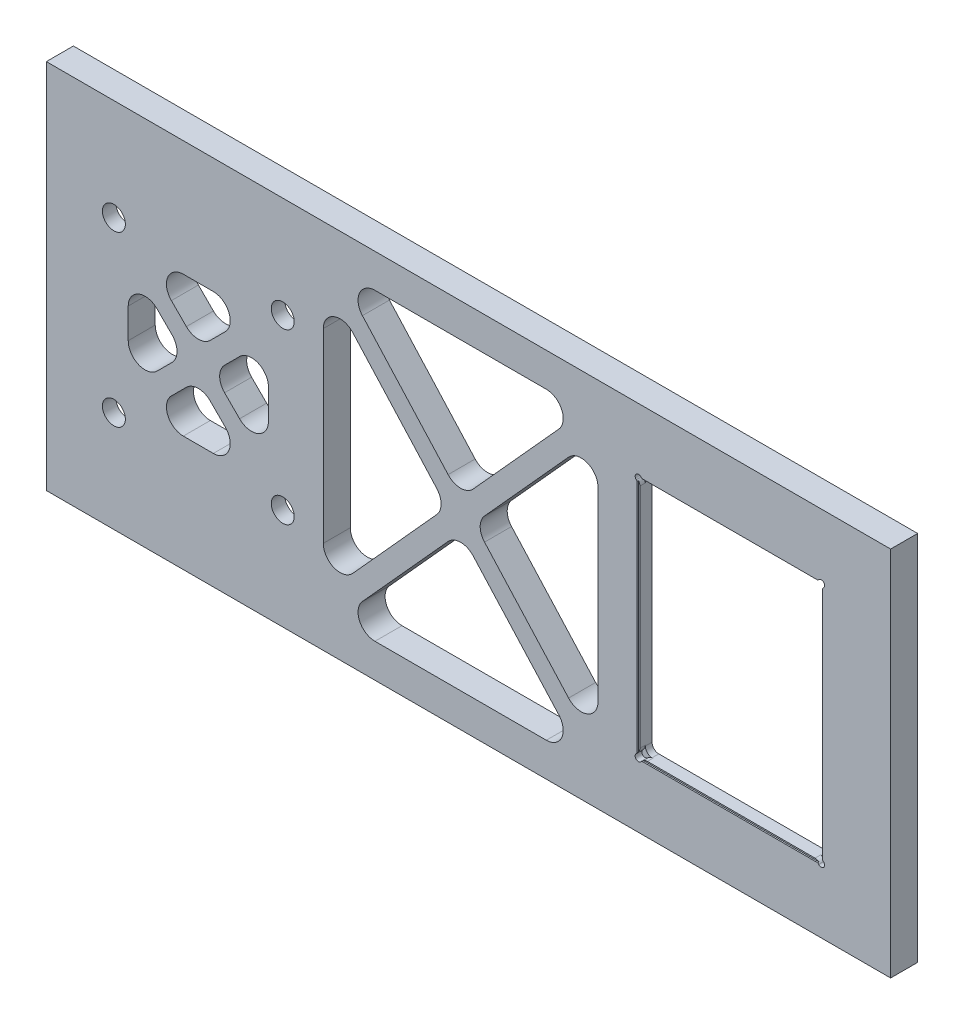
from build123d import *

# Parameters (mm, degrees)
SKETCH1_R           = 1.6999999999999995
SKETCH1_W           = 27.05000000000001
SKETCH1_H           = 35.849999999999994
BOSS_EXTRUDE1_DEPTH = 4
SKETCH2_R           = 0.49999999999999917
CUT_EXTRUDE1_DEPTH  = 1
FILLET1_R           = 1
FILLET2_R           = 1
SKETCH7_W           = 27.450000000000074
SKETCH7_H           = 36.250000000000014
CUT_EXTRUDE2_DEPTH  = 0.2
CUT_EXTRUDE3_DEPTH  = 2
CUT_EXTRUDE4_DEPTH  = 1
CUT_EXTRUDE5_DEPTH  = 137.6235704408284
CUT_EXTRUDE6_DEPTH  = 137.6235704408284
FILLET3_R           = 2.5
SKETCH12_R          = 4.999999999999999
SKETCH12_R_2        = 5.000000000000001
CUT_EXTRUDE7_DEPTH  = 2


with BuildPart() as part:
    # Sketch1 → Boss-Extrude1 (new body)
    with BuildSketch(Plane.XY):
        Polygon((0, 0), (125, 2.776e-14), (125, 54.99999999999999), (0, 54.99999999999999), align=None)
        with Locations((10, 39.99999999999999)):
            Circle(SKETCH1_R, mode=Mode.SUBTRACT)
        with Locations((35, 39.999999999999986)):
            Circle(SKETCH1_R, mode=Mode.SUBTRACT)
        with Locations((10, 15)):
            Circle(SKETCH1_R, mode=Mode.SUBTRACT)
        with Locations((35, 15.000000000000014)):
            Circle(SKETCH1_R, mode=Mode.SUBTRACT)
        with Locations((101.2, 27.500000000000007)):
            Rectangle(SKETCH1_W, SKETCH1_H, mode=Mode.SUBTRACT)
    extrude(amount=BOSS_EXTRUDE1_DEPTH)

    # Sketch2 → Cut-Extrude1 (cut)
    with BuildSketch(Plane.XY.offset(4)):
        with Locations((87.675, 45.425000000000004)):
            Circle(SKETCH2_R)
        with Locations((114.72500000000001, 45.425000000000004)):
            Circle(SKETCH2_R)
        with Locations((87.675, 9.575000000000006)):
            Circle(SKETCH2_R)
        with Locations((114.72500000000001, 9.575000000000006)):
            Circle(SKETCH2_R)
    extrude(amount=-CUT_EXTRUDE1_DEPTH, mode=Mode.SUBTRACT)

    # Fillet1
    # the kernel refuses this fillet: 1 mm, written as the material it adds along each edge
    with BuildSketch(Plane(origin=(114.72500000000001, 9.575000000000006, 0), x_dir=(-1, 0, 0), z_dir=(0, 0, 1))) as fillet1_piece_1_section:
        with BuildLine():
            CenterArc((FILLET1_R, -FILLET1_R), FILLET1_R, 90, 90.00000000000023)
            Line((0, -FILLET1_R), (0, 0))
            Line((0, 0), (FILLET1_R, 0))
        make_face()
    fillet1_piece_1 = extrude(amount=5.500000000000009, mode=Mode.PRIVATE)
    fillet1_piece_1 = split(fillet1_piece_1, bisect_by=Plane(origin=(114.10706425748403, 9.617383677219156, 4), z_dir=(0, 0, -1)), keep=Keep.TOP, mode=Mode.PRIVATE)
    fillet1_piece_1 = fillet1_piece_1 - Plane(origin=(114.72500000000001, 9.575000000000006, 1.5000000000000009), x_dir=(1, 0, 0), z_dir=(0, 0, 1)) * Cylinder(0.49999999999999917, 16, mode=Mode.PRIVATE)
    add(fillet1_piece_1)
    with BuildSketch(Plane(origin=(114.72500000000001, 9.575000000000006, 0), x_dir=(-1, 0, 0), z_dir=(0, 0, 1))) as fillet1_piece_2:
        with BuildLine():
            CenterArc((FILLET1_R, -FILLET1_R), FILLET1_R, 90, 90.00000000000023)
            Line((0, -FILLET1_R), (0, 0))
            Line((0, 0), (FILLET1_R, 0))
        make_face()
    extrude(amount=3)
    with BuildSketch(Plane(origin=(87.675, 9.575000000000006, 0), x_dir=(0, 1, 0), z_dir=(0, 0, 1))) as fillet1_piece_3_section:
        with BuildLine():
            CenterArc((FILLET1_R, -FILLET1_R), FILLET1_R, 90, 90)
            Line((0, -FILLET1_R), (0, 0))
            Line((0, 0), (FILLET1_R, 0))
        make_face()
    fillet1_piece_3 = extrude(amount=5.5, mode=Mode.PRIVATE)
    fillet1_piece_3 = split(fillet1_piece_3, bisect_by=Plane(origin=(87.71738367721915, 10.192935742515996, 4), z_dir=(0, 0, -1)), keep=Keep.TOP, mode=Mode.PRIVATE)
    fillet1_piece_3 = fillet1_piece_3 - Plane(origin=(87.675, 9.575000000000006, 1.5000000000000022), x_dir=(1, 0, 0), z_dir=(0, 0, 1)) * Cylinder(0.49999999999999917, 15, mode=Mode.PRIVATE)
    add(fillet1_piece_3)
    with BuildSketch(Plane(origin=(87.675, 9.575000000000006, 0), x_dir=(0, 1, 0), z_dir=(0, 0, 1))) as fillet1_piece_4:
        with BuildLine():
            CenterArc((FILLET1_R, -FILLET1_R), FILLET1_R, 90, 90)
            Line((0, -FILLET1_R), (0, 0))
            Line((0, 0), (FILLET1_R, 0))
        make_face()
    extrude(amount=3)
    with BuildSketch(Plane(origin=(114.72500000000001, 45.425000000000004, 0), x_dir=(0, -1, 0), z_dir=(0, 0, 1))) as fillet1_piece_5_section:
        with BuildLine():
            CenterArc((FILLET1_R, -FILLET1_R), FILLET1_R, 90, 90)
            Line((0, -FILLET1_R), (0, 0))
            Line((0, 0), (FILLET1_R, 0))
        make_face()
    fillet1_piece_5 = extrude(amount=5.5, mode=Mode.PRIVATE)
    fillet1_piece_5 = split(fillet1_piece_5, bisect_by=Plane(origin=(114.68261632278086, 44.807064257484015, 4), z_dir=(0, 0, -1)), keep=Keep.TOP, mode=Mode.PRIVATE)
    fillet1_piece_5 = fillet1_piece_5 - Plane(origin=(114.72500000000001, 45.425000000000004, 1.5000000000000009), x_dir=(1, 0, 0), z_dir=(0, 0, 1)) * Cylinder(0.49999999999999917, 15, mode=Mode.PRIVATE)
    add(fillet1_piece_5)
    with BuildSketch(Plane(origin=(114.72500000000001, 45.425000000000004, 0), x_dir=(0, -1, 0), z_dir=(0, 0, 1))) as fillet1_piece_6:
        with BuildLine():
            CenterArc((FILLET1_R, -FILLET1_R), FILLET1_R, 90, 90)
            Line((0, -FILLET1_R), (0, 0))
            Line((0, 0), (FILLET1_R, 0))
        make_face()
    extrude(amount=3)
    with BuildSketch(Plane(origin=(87.675, 45.425000000000004, 0), x_dir=(0, -1, 0), z_dir=(0, 0, 1))) as fillet1_piece_7_section:
        with BuildLine():
            CenterArc((FILLET1_R, FILLET1_R), FILLET1_R, 180, 90)
            Line((7.11e-15, FILLET1_R), (0, 0))
            Line((0, 0), (FILLET1_R, 0))
        make_face()
    fillet1_piece_7 = extrude(amount=5.500000000000018, mode=Mode.PRIVATE)
    fillet1_piece_7 = split(fillet1_piece_7, bisect_by=Plane(origin=(87.71738367721916, 44.807064257484015, 4), z_dir=(0, 0, -1)), keep=Keep.TOP, mode=Mode.PRIVATE)
    fillet1_piece_7 = fillet1_piece_7 - Plane(origin=(87.675, 45.425000000000004, 1.5), x_dir=(1, 0, 0), z_dir=(0, 0, 1)) * Cylinder(0.49999999999999917, 16, mode=Mode.PRIVATE)
    add(fillet1_piece_7)
    with BuildSketch(Plane(origin=(87.675, 45.425000000000004, 0), x_dir=(0, -1, 0), z_dir=(0, 0, 1))) as fillet1_piece_8:
        with BuildLine():
            CenterArc((FILLET1_R, FILLET1_R), FILLET1_R, 180, 90)
            Line((7.11e-15, FILLET1_R), (0, 0))
            Line((0, 0), (FILLET1_R, 0))
        make_face()
    extrude(amount=3)

    # Fillet2
    # the kernel refuses this fillet: 1 mm, written as the material it takes off along each edge
    with BuildSketch(Plane(origin=(114.24714054305846, 9.722140543058465, 5.642166576865002), x_dir=(-0.9745882982080014, -0.22400368076447263, 0), z_dir=(0, 0, -1))) as fillet2_piece_1:
        with BuildLine():
            CenterArc((0.8808703115104601, -0.9745882982080014), FILLET2_R, 102.94429793424341, 48.189685104221226)
            Line((0.00511929604450839, -0.49182525186917403), (-0.08245580550209228, -0.44354894723529276))
            ThreePointArc((-0.08245580550209228, -0.44354894723529276), (-0.03277787842748482, -0.24628044612821973), (-0.08655124233769046, -0.05008874573995264))
            Line((-0.08655124233769046, -0.05008874573995264), (0.03178284057550912, 0.09481482502727105))
            ThreePointArc((0.03178284057550912, 0.09481482502727105), (0.5194317184430866, 0.07101878188551296), (0.6344662626695403, 0.09745882982079979))
            Line((0.6344662626695403, 0.09745882982079979), (0.6568666307459875, 0))
        make_face()
    extrude(amount=2.6421665768650016, mode=Mode.SUBTRACT)
    with BuildSketch(Plane(origin=(114.57785945694152, 10.052859456941535, 5.642166576864939), x_dir=(0.22400368076451158, 0.9745882982079924, 0), z_dir=(0, 0, -1))) as fillet2_piece_2:
        with BuildLine():
            CenterArc((0.880870311510496, 0.9745882982079924), FILLET2_R, 208.86601696153332, 48.189685104220985)
            Line((0.00511929604452377, 0.49182525186919485), (-0.08245580550207285, 0.44354894723531935))
            ThreePointArc((-0.08245580550207285, 0.44354894723531935), (-0.03277787842748298, 0.2462804461282338), (-0.08655124233769111, 0.05008874573996035))
            Line((-0.08655124233769111, 0.05008874573996035), (0.03178284057550186, -0.09481482502727152))
            ThreePointArc((0.03178284057550186, -0.09481482502727152), (0.5194317184430818, -0.0710187818855023), (0.6344662626695345, -0.09745882982079371))
            Line((0.6344662626695345, -0.09745882982079371), (0.6568666307459844, -1e-17))
        make_face()
    extrude(amount=2.6421665768649394, mode=Mode.SUBTRACT)
    with BuildSketch(Plane(origin=(87.82214054305847, 10.052859456941533, 5.6421665768649705), x_dir=(-0.22400368076448748, 0.974588298207998, 0), z_dir=(0, 0, -1))) as fillet2_piece_3:
        with BuildLine():
            CenterArc((0.8808703115104791, -0.9745882982079979), FILLET2_R, 102.94429793424429, 48.189685104221056)
            Line((0.00511929604451708, -0.49182525186917914), (-0.08245580550207834, -0.4435489472353014))
            ThreePointArc((-0.08245580550207834, -0.4435489472353014), (-0.03277787842748734, -0.24628044612823258), (-0.08655124233769235, -0.05008874573995822))
            Line((-0.08655124233769235, -0.05008874573995822), (0.03178284057550421, 0.09481482502727073))
            ThreePointArc((0.03178284057550421, 0.09481482502727073), (0.5194317184430803, 0.07101878188550331), (0.6344662626695442, 0.09745882982079428))
            Line((0.6344662626695442, 0.09745882982079428), (0.6568666307459916, 1e-17))
        make_face()
    extrude(amount=2.6421665768649705, mode=Mode.SUBTRACT)
    with BuildSketch(Plane(origin=(88.15285945694153, 9.722140543058465, 5.642166576865002), x_dir=(0.9745882982080024, -0.22400368076446792, 0), z_dir=(0, 0, -1))) as fillet2_piece_4:
        with BuildLine():
            CenterArc((0.8808703115104692, 0.9745882982080024), FILLET2_R, 208.86601696153488, 48.18968510422201)
            Line((0.00511929604450721, 0.4918252518691792), (-0.08245580550209324, 0.4435489472352975))
            ThreePointArc((-0.08245580550209324, 0.4435489472352975), (-0.0327778784274852, 0.246280446128223), (-0.0865512423376907, 0.05008874573995222))
            Line((-0.0865512423376907, 0.05008874573995222), (0.03178284057550957, -0.0948148250272709))
            ThreePointArc((0.03178284057550957, -0.0948148250272709), (0.5194317184430869, -0.07101878188551045), (0.6344662626695546, -0.09745882982079991))
            Line((0.6344662626695546, -0.09745882982079991), (0.6568666307460013, -2e-17))
        make_face()
    extrude(amount=2.6421665768650016, mode=Mode.SUBTRACT)
    with BuildSketch(Plane(origin=(114.57785945694152, 44.94714054305846, 5.642166576864965), x_dir=(0.22400368076451097, -0.9745882982079925, 0), z_dir=(0, 0, -1))) as fillet2_piece_5:
        with BuildLine():
            CenterArc((0.8808703115104971, -0.9745882982079926), FILLET2_R, 102.94429793424567, 48.189685104220956)
            Line((0.00511929604452519, -0.4918252518691944), (-0.08245580550206966, -0.44354894723531846))
            ThreePointArc((-0.08245580550206966, -0.44354894723531846), (-0.03277787842748659, -0.24628044612823458), (-0.08655124233769461, -0.0500887457399611))
            Line((-0.08655124233769461, -0.0500887457399611), (0.03178284057550539, 0.0948148250272723))
            ThreePointArc((0.03178284057550539, 0.0948148250272723), (0.5194317184430904, 0.07101878188550396), (0.6344662626695363, 0.09745882982079372))
            Line((0.6344662626695363, 0.09745882982079372), (0.6568666307459862, 1e-17))
        make_face()
    extrude(amount=2.642166576864965, mode=Mode.SUBTRACT)
    with BuildSketch(Plane(origin=(114.24714054305846, 45.277859456941535, 5.6421665768650096), x_dir=(-0.974588298207999, 0.22400368076448335, 0), z_dir=(0, 0, -1))) as fillet2_piece_6:
        with BuildLine():
            CenterArc((0.8808703115104871, 0.974588298207999), FILLET2_R, 208.86601696153414, 48.18968510422178)
            Line((0.00511929604451658, 0.49182525186918613), (-0.08245580550208544, 0.4435489472353023))
            ThreePointArc((-0.08245580550208544, 0.4435489472353023), (-0.03277787842748132, 0.24628044612822356), (-0.0865512423376907, 0.05008874573995013))
            Line((-0.0865512423376907, 0.05008874573995013), (0.03178284057550808, -0.09481482502727141))
            ThreePointArc((0.03178284057550808, -0.09481482502727141), (0.5194317184430862, -0.07101878188551694), (0.6344662626695551, -0.09745882982080127))
            Line((0.6344662626695551, -0.09745882982080127), (0.6568666307460037, 1e-17))
        make_face()
    extrude(amount=2.6421665768650096, mode=Mode.SUBTRACT)
    with BuildSketch(Plane(origin=(87.82214054305847, 44.94714054305846, 5.642166576864957), x_dir=(-0.22400368076448568, -0.9745882982079984, 0), z_dir=(0, 0, -1))) as fillet2_piece_7:
        with BuildLine():
            CenterArc((0.8808703115104826, 0.9745882982079985), FILLET2_R, 208.86601696153457, 48.18968510422121)
            Line((0.00511929604451617, 0.49182525186917914), (-0.08245580550207744, 0.4435489472353009))
            ThreePointArc((-0.08245580550207744, 0.4435489472353009), (-0.03277787842749299, 0.24628044612823374), (-0.08655124233769591, 0.05008874573995886))
            Line((-0.08655124233769591, 0.05008874573995886), (0.03178284057550785, -0.09481482502727148))
            ThreePointArc((0.03178284057550785, -0.09481482502727148), (0.5194317184430822, -0.07101878188550274), (0.6344662626695495, -0.09745882982079429))
            Line((0.6344662626695495, -0.09745882982079429), (0.6568666307459968, 0))
        make_face()
    extrude(amount=2.642166576864957, mode=Mode.SUBTRACT)
    with BuildSketch(Plane(origin=(88.15285945694153, 45.277859456941535, 5.642166576864975), x_dir=(0.974588298207998, 0.22400368076448807, 0), z_dir=(0, 0, -1))) as fillet2_piece_8:
        with BuildLine():
            CenterArc((0.8808703115104781, -0.974588298207998), FILLET2_R, 102.94429793424433, 48.189685104220985)
            Line((0.00511929604451736, -0.4918252518691792), (-0.08245580550208488, -0.4435489472352958))
            ThreePointArc((-0.08245580550208488, -0.4435489472352958), (-0.03277787842748014, -0.24628044612822372), (-0.08655124233769046, -0.05008874573995056))
            Line((-0.08655124233769046, -0.05008874573995056), (0.03178284057550762, 0.09481482502727157))
            ThreePointArc((0.03178284057550762, 0.09481482502727157), (0.5194317184430874, 0.07101878188551251), (0.6344662626695409, 0.09745882982080117))
            Line((0.6344662626695409, 0.09745882982080117), (0.65686663074599, 0))
        make_face()
    extrude(amount=2.642166576864975, mode=Mode.SUBTRACT)

    # Sketch7 → Cut-Extrude2 (cut)
    with BuildSketch(Plane.XY.offset(4)):
        with Locations((101.20000000000002, 27.500000000000007)):
            Rectangle(SKETCH7_W, SKETCH7_H)
    extrude(amount=-CUT_EXTRUDE2_DEPTH, mode=Mode.SUBTRACT)

    # Sketch8 → Cut-Extrude3 (cut)
    with BuildSketch(Plane(origin=(0, 0, 0), x_dir=(-1, 0, 0), z_dir=(0, 0, -1))):
        with BuildLine():
            Line((-116.22500000000001, 44.425000000000004), (-116.225, 10.575000000000008))
            ThreePointArc((-116.225, 10.575000000000008), (-115.49276695296636, 8.80723304703365), (-113.72500000000001, 8.075000000000008))
            Line((-113.72500000000001, 8.075000000000008), (-88.675, 8.075000000000008))
            ThreePointArc((-88.675, 8.075000000000008), (-86.90723304703363, 8.80723304703364), (-86.175, 10.575000000000008))
            Line((-86.175, 10.575000000000008), (-86.17499999999998, 44.425000000000004))
            ThreePointArc((-86.17499999999998, 44.425000000000004), (-86.90723304703361, 46.19276695296638), (-88.675, 46.92500000000001))
            Line((-88.675, 46.92500000000001), (-113.72500000000001, 46.925000000000004))
            ThreePointArc((-113.72500000000001, 46.925000000000004), (-115.49276695296638, 46.19276695296637), (-116.22500000000001, 44.425000000000004))
        make_face()
    extrude(amount=-CUT_EXTRUDE3_DEPTH, mode=Mode.SUBTRACT)

    # Sketch9 → Cut-Extrude4 (cut)
    with BuildSketch(Plane(origin=(0, 0, 0), x_dir=(-1, 0, 0), z_dir=(0, 0, -1))):
        with BuildLine():
            Line((-117.72500000000001, 44.425000000000004), (-117.72500000000001, 10.575000000000008))
            ThreePointArc((-117.72500000000001, 10.575000000000008), (-116.5534271247462, 7.746572875253818), (-113.72500000000001, 6.575000000000006))
            Line((-113.72500000000001, 6.575000000000006), (-88.675, 6.575000000000006))
            ThreePointArc((-88.675, 6.575000000000006), (-85.8465728752538, 7.7465728752538165), (-84.675, 10.575000000000008))
            Line((-84.675, 10.575000000000008), (-84.67499999999998, 44.425000000000004))
            ThreePointArc((-84.67499999999998, 44.425000000000004), (-85.8465728752538, 47.2534271247462), (-88.675, 48.42500000000001))
            Line((-88.675, 48.42500000000001), (-113.72500000000001, 48.42500000000001))
            ThreePointArc((-113.72500000000001, 48.42500000000001), (-116.55342712474621, 47.253427124746196), (-117.72500000000001, 44.425000000000004))
        make_face()
    extrude(amount=-CUT_EXTRUDE4_DEPTH, mode=Mode.SUBTRACT)

    # Sketch10 → Cut-Extrude5 (cut, through all)
    with BuildSketch(Plane(origin=(0, 0, 0), x_dir=(-1, 0, 0), z_dir=(0, 0, -1))):
        Polygon((-32.87867965644036, 35.7573593128807), (-24.621320343559653, 27.499999999999996), (-32.87867965644036, 19.242640687119284), align=None)
        Polygon((-30.75735931288072, 37.87867965644035), (-14.242640687119303, 37.87867965644035), (-22.50000000000001, 29.62132034355964), align=None)
        Polygon((-30.75735931288072, 17.121320343559645), (-22.500000000000007, 25.378679656440358), (-14.242640687119293, 17.12132034355965), align=None)
        Polygon((-12.121320343559654, 35.7573593128807), (-20.378679656440358, 27.499999999999996), (-12.121320343559654, 19.24264068711929), align=None)
    extrude(amount=-CUT_EXTRUDE5_DEPTH, mode=Mode.SUBTRACT)

    # Sketch11 → Cut-Extrude6 (cut, through all)
    with BuildSketch(Plane(origin=(0, 0, 0), x_dir=(-1, 0, 0), z_dir=(0, 0, -1))):
        Polygon((-81.67500000000001, 47.76305409311363), (-63.359450550280044, 27.49999999999998), (-81.67500000000001, 7.236945906886298), align=None)
        Polygon((-79.65304944971997, 49.99999999999999), (-43.02195055028005, 49.99999999999999), (-61.337500000000006, 29.73694590688633), align=None)
        Polygon((-79.65304944971993, 4.999999999999997), (-61.33750000000001, 25.263054093113627), (-43.02195055028008, 4.999999999999997), align=None)
        Polygon((-41, 47.76305409311365), (-59.31554944971996, 27.499999999999986), (-41, 7.236945906886325), align=None)
    extrude(amount=-CUT_EXTRUDE6_DEPTH, mode=Mode.SUBTRACT)

    # Fillet3
    fillet3_edges = [part.edges().sort_by_distance(p)[0] for p in [
        (22.50000000000001, 29.62132034355964, 2),
        (30.75735931288072, 37.87867965644035, 2),
        (14.242640687119303, 37.87867965644035, 2),
        (14.242640687119293, 17.12132034355965, 2),
        (30.75735931288072, 17.121320343559645, 2),
        (22.500000000000007, 25.378679656440358, 2),
        (12.121320343559654, 35.7573593128807, 2),
        (12.121320343559654, 19.24264068711929, 2),
        (20.378679656440358, 27.499999999999996, 2),
        (32.87867965644036, 19.242640687119284, 2),
        (32.87867965644036, 35.7573593128807, 2),
        (24.621320343559653, 27.499999999999996, 2),
        (61.337500000000006, 29.73694590688633, 2),
        (79.65304944971997, 49.99999999999999, 2),
        (43.02195055028005, 49.99999999999999, 2),
        (43.02195055028008, 4.999999999999997, 2),
        (79.65304944971993, 4.999999999999997, 2),
        (61.33750000000001, 25.263054093113627, 2),
        (41, 47.76305409311365, 2),
        (41, 7.236945906886325, 2),
        (59.31554944971996, 27.499999999999986, 2),
        (81.67500000000001, 7.236945906886298, 2),
        (81.67500000000001, 47.76305409311363, 2),
        (63.359450550280044, 27.49999999999998, 2),
    ]]
    fillet(fillet3_edges, radius=FILLET3_R)

    # Sketch12 → Cut-Extrude7 (cut)
    with BuildSketch(Plane(origin=(0, 0, 0), x_dir=(-1, 0, 0), z_dir=(0, 0, -1))):
        with Locations((-35, 39.999999999999986)):
            Circle(SKETCH12_R)
        with Locations((-10, 39.99999999999999)):
            Circle(SKETCH12_R)
        with Locations((-35, 15.000000000000014)):
            Circle(SKETCH12_R_2)
        with Locations((-10, 15)):
            Circle(SKETCH12_R_2)
    extrude(amount=-CUT_EXTRUDE7_DEPTH, mode=Mode.SUBTRACT)


solid = part.part
